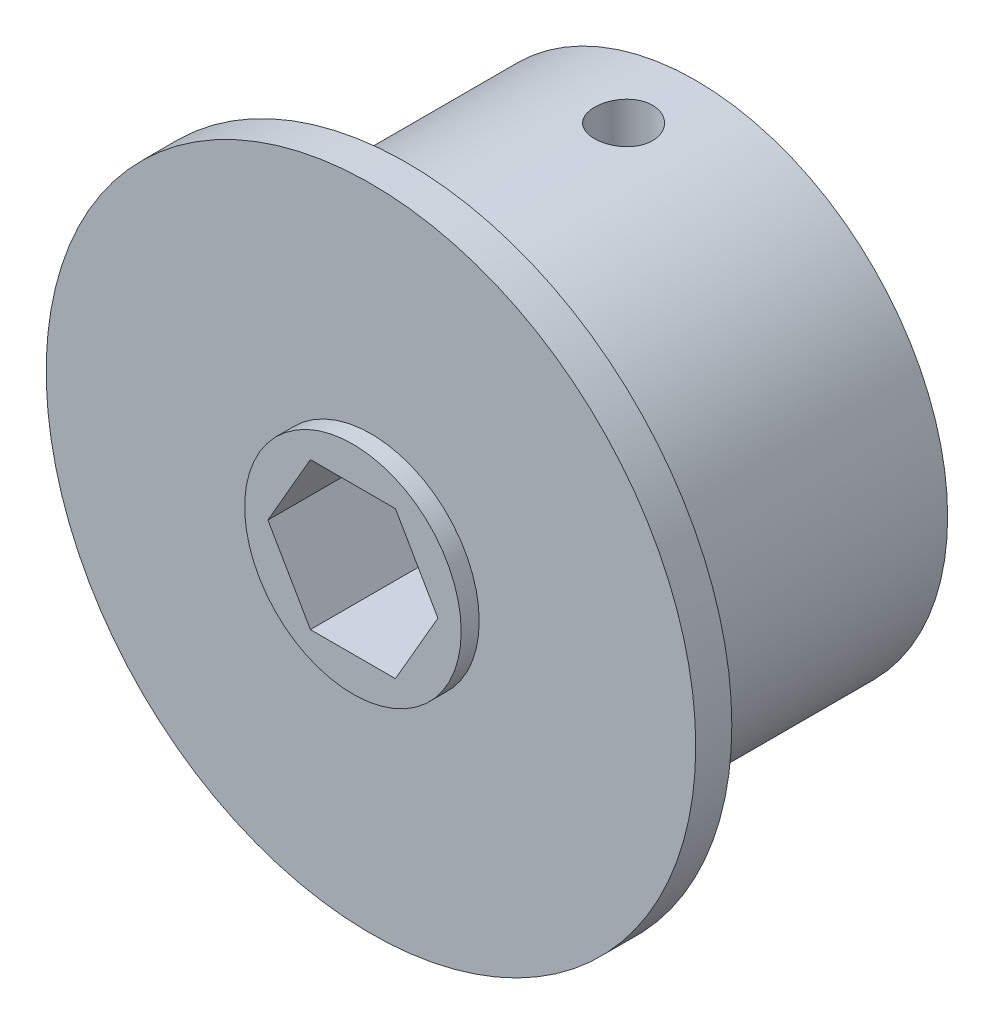
from build123d import *

# Parameters (mm, degrees)
SKETCH1_R               = 22.1615
BOSS_EXTRUDE1_DEPTH     = 12.7
SKETCH2_R               = 28.575
BOSS_EXTRUDE2_DEPTH     = 3.175
BOSS_EXTRUDE3_START     = 12.7
SKETCH3_R               = 22.1615
BOSS_EXTRUDE3_DEPTH     = 12.7
CUT_EXTRUDE1_DEPTH      = 44.417472001
CUT_EXTRUDE1_DEPTH_BACK = 44.417472001
SKETCH4_R               = 2.5527
SKETCH5_R               = 9.525
BOSS_EXTRUDE4_DEPTH     = 1.5875


with BuildPart() as part:
    # Sketch1 → Boss-Extrude1 (new body)
    with BuildSketch(Plane.XY):
        Circle(SKETCH1_R)
        Polygon((7.478995387, 0), (3.739497694, 6.477), (-3.739497694, 6.477), (-7.478995387, 0), (-3.739497694, -6.477), (3.739497694, -6.477), align=None, mode=Mode.SUBTRACT)
    extrude(amount=BOSS_EXTRUDE1_DEPTH)

    # Sketch2 → Boss-Extrude2 (add)
    with BuildSketch(Plane.XY.offset(12.7)):
        Circle(SKETCH2_R)
        Polygon((7.478995387, 0), (3.739497694, 6.477), (-3.739497694, 6.477), (-7.478995387, 0), (-3.739497694, -6.477), (3.739497694, -6.477), align=None, mode=Mode.SUBTRACT)
    extrude(amount=BOSS_EXTRUDE2_DEPTH)

    # Sketch3 → Boss-Extrude3 (add)
    with BuildSketch(Plane(origin=(0, 0, 0), x_dir=(-1, 0, 0), z_dir=(0, 0, -1)).offset(BOSS_EXTRUDE3_START)):
        Circle(SKETCH3_R)
    extrude(amount=-BOSS_EXTRUDE3_DEPTH)

    # Sketch4 → Cut-Extrude1 (cut, two sides: drawn at the far end of the back side and taken through both)
    with BuildSketch(Plane(origin=(0, 0, 0), x_dir=(1, 0, 0), z_dir=(0, 1, 0)).offset(-CUT_EXTRUDE1_DEPTH_BACK)):
        with Locations((0, 6.35)):
            Circle(SKETCH4_R)
    extrude(amount=CUT_EXTRUDE1_DEPTH + CUT_EXTRUDE1_DEPTH_BACK, mode=Mode.SUBTRACT)

    # Sketch5 → Boss-Extrude4 (add)
    with BuildSketch(Plane.XY.offset(15.875)):
        Circle(SKETCH5_R)
        Polygon((7.478995387, 0), (3.739497694, 6.477), (-3.739497694, 6.477), (-7.478995387, 0), (-3.739497694, -6.477), (3.739497694, -6.477), align=None, mode=Mode.SUBTRACT)
    extrude(amount=BOSS_EXTRUDE4_DEPTH)


solid = part.part
